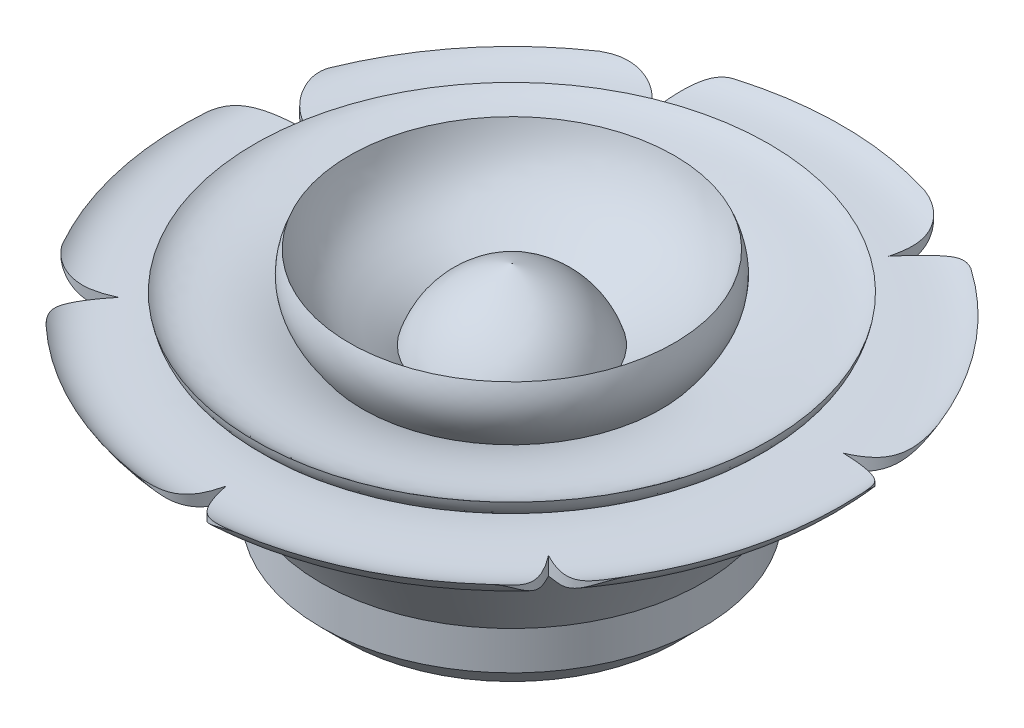
from build123d import *

# Parameters (mm, degrees)
SKETCH2_R           = 9.4615
BOSS_EXTRUDE1_DEPTH = 3.175
CUT_EXTRUDE2_START  = -1.399690459
CUT_EXTRUDE2_DEPTH  = 1.399690459
CHAMFER1_SIZE       = 1.27


# Read off the part's stored shape, not the designer's step: Cut-Extrude2
with BuildPart() as part:
    # Sketch2 → Boss-Extrude1 (new body)
    with BuildSketch(Plane(origin=(0, 0, 0), x_dir=(1, 0, 0), z_dir=(0, 1, 0))):
        with Locations(Location((0, 0, 0), (0, 0, 270))):
            Circle(SKETCH2_R)
    extrude(amount=BOSS_EXTRUDE1_DEPTH)

    # Sketch3 → Revolve3 (revolve)
    with BuildSketch(Plane.XY, mode=Mode.PRIVATE) as revolve3_sk:
        with BuildLine():
            Line((9.4615, 3.175), (7.257823032, 3.175))
            Line((7.257823032, 3.175), (0, 3.175))
            Line((0, 3.175), (0, 12.153777725))
            add(Edge.make_bspline(
                [(0, 12.153777725), (2.13831123, 11.520061757), (3.477438717, 10.35543051), (4.017382463, 8.659883983)],
                knots=[0, 0, 0, 0, 0.540148016, 0.540148016, 0.540148016, 0.540148016], degree=3))
            add(Edge.make_bspline(
                [(4.017382463, 8.659883983), (5.851465131, 10.086959119), (7.298214322, 10.2332866), (8.052368445, 12.767244451)],
                knots=[0, 0, 0, 0, 1, 1, 1, 1], degree=3))
            add(Edge.make_bspline(
                [(7.398197715, 9.601986331), (8.244792265, 10.726441803), (8.557447355, 11.59769491), (8.052368445, 12.767244451)],
                knots=[0, 0, 0, 0, 1, 1, 1, 1], degree=3))
            add(Edge.make_bspline(
                [(7.398197715, 9.601986331), (10.053387197, 10.692724475), (11.796833397, 10.086140267), (12.745602962, 10.91990746)],
                knots=[0, 0, 0, 0, 1, 1, 1, 1], degree=3))
            add(Edge.make_bspline(
                [(8.095139787, 8.271903754), (10.420551443, 10.443790106), (12.411212144, 9.114120654), (12.745602962, 10.91990746)],
                knots=[0, 0, 0, 0, 1, 1, 1, 1], degree=3))
            add(Edge.make_bspline(
                [(8.095139787, 8.271903754), (12.127769803, 10.276347103), (15.085679098, 8.73631301), (16.340420889, 9.921346924)],
                knots=[0, 0, 0, 0, 1, 1, 1, 1], degree=3))
            add(Edge.make_bspline(
                [(14.637486624, 8.782698369), (15.364691678, 8.939207775), (15.934935962, 9.201598821), (16.340420889, 9.921346924)],
                knots=[0, 0, 0, 0, 1, 1, 1, 1], degree=3))
            add(Edge.make_bspline(
                [(12.139796433, 7.333193021), (13.080422963, 8.334541193), (14.637486624, 8.782698369)],
                knots=[0, 0, 0, 1, 1, 1], degree=2))
            Line((12.139796433, 7.333193021), (9.4615, 3.175))
        make_face()
    revolve(revolve3_sk.sketch.rotate(Axis((0, 0, 0), (0, 1, 0)), 270), axis=Axis((0, 0, 0), (0, 1, 0)))

    # Cut-Extrude2 outline → Cut-Extrude2 (cut)
    with BuildSketch(Plane(origin=(0, 9.921346924, 0), x_dir=(1, 0, 0), z_dir=(0, 1, 0)).offset(CUT_EXTRUDE2_START)):
        with BuildLine():
            add(Edge.make_bspline(
                [(-14.237029797, -8.019746718), (-13.662066602, -9.034765434), (-12.593066917, -9.176553695), (-11.030030742, -8.4451115)],
                knots=[0.0017363, 0.0017363, 0.0017363, 0.0017363, 0.458470686, 0.458470686, 0.458470686, 0.458470686], degree=3))
            ThreePointArc((-14.237029797, -8.019746718), (-12.840268084, -10.10627876), (-11.140325119, -11.954183832))
            add(Edge.make_bspline(
                [(-11.140325119, -11.954183832), (-12.138953872, -10.949429748), (-12.284756509, -9.899430024), (-11.030030742, -8.4451115)],
                knots=[0, 0, 0, 0, 0.483922941, 0.483922941, 0.483922941, 0.483922941], degree=3))
        make_face()
        with BuildLine():
            add(Edge.make_bspline(
                [(-2.619707489, -16.129057242), (-1.445527982, -16.2033572), (-0.678660536, -15.573522396), (-0.274457322, -13.889065393)],
                knots=[0, 0, 0, 0, 0.45847077, 0.45847077, 0.45847077, 0.45847077], degree=3))
            ThreePointArc((-2.619707489, -16.129057242), (-0.111032443, -16.340043655), (2.400278166, -16.163168612))
            add(Edge.make_bspline(
                [(2.400278166, -16.163168612), (0.980444158, -16.208481277), (0.080266003, -15.776802052), (-0.274457322, -13.889065393)],
                knots=[0, 0, 0, 0, 0.483922915, 0.483922915, 0.483922915, 0.483922915], degree=3))
        make_face()
        with BuildLine():
            add(Edge.make_bspline(
                [(10.986712076, -12.095516219), (11.848340818, -11.309105631), (11.748698667, -10.235356266), (10.687786979, -8.874269864)],
                knots=[0.001736298, 0.001736298, 0.001736298, 0.001736298, 0.458470686, 0.458470686, 0.458470686, 0.458470686], degree=3))
            ThreePointArc((10.986712076, -12.095516219), (12.710121691, -10.269477175), (14.133423035, -8.200957758))
            add(Edge.make_bspline(
                [(14.133423035, -8.200957758), (13.363767984, -9.428104646), (12.384845451, -9.773920721), (10.687786979, -8.874269864)],
                knots=[0, 0, 0, 0, 0.483922941, 0.483922941, 0.483922941, 0.483922941], degree=3))
        make_face()
        with BuildLine():
            add(Edge.make_bspline(
                [(16.306758312, 1.048326379), (16.22913449, 2.212293837), (15.327517567, 2.803862246), (13.601909749, 2.823031579)],
                knots=[0.001736298, 0.001736298, 0.001736298, 0.001736298, 0.458470686, 0.458470686, 0.458470686, 0.458470686], degree=3))
            ThreePointArc((16.306758312, 1.048326379), (15.953631818, 3.534258995), (15.223812089, 5.936741556))
            add(Edge.make_bspline(
                [(15.223812089, 5.936741556), (15.684063875, 4.593224131), (15.363383763, 3.588922185), (13.601909749, 2.823031579)],
                knots=[0, 0, 0, 0, 0.483922941, 0.483922941, 0.483922941, 0.483922941], degree=3))
        make_face()
        with BuildLine():
            add(Edge.make_bspline(
                [(9.358410555, 13.395129963), (8.289129817, 14.036764565), (7.368550306, 13.736798705), (6.273517267, 12.39453293)],
                knots=[0, 0, 0, 0, 0.458470655, 0.458470655, 0.458470655, 0.458470655], degree=3))
            ThreePointArc((9.358410555, 13.395129963), (7.189716012, 14.673695462), (4.850360131, 15.603953391))
            add(Edge.make_bspline(
                [(4.850360131, 15.603953391), (6.22843121, 15.110529703), (6.772981165, 14.249233767), (6.273517267, 12.39453293)],
                knots=[0, 0, 0, 0, 0.483923025, 0.483923025, 0.483923025, 0.483923025], degree=3))
        make_face()
        with BuildLine():
            add(Edge.make_bspline(
                [(-4.650637756, 15.664639265), (-5.768149423, 15.329954438), (-6.144257485, 14.3193073), (-5.778961944, 12.63269785)],
                knots=[0.0017363, 0.0017363, 0.0017363, 0.0017363, 0.458470784, 0.458470784, 0.458470784, 0.458470784], degree=3))
            ThreePointArc((-4.650637756, 15.664639265), (-6.995664805, 14.767194344), (-9.175511935, 13.52107006))
            add(Edge.make_bspline(
                [(-9.175511935, 13.52107006), (-7.897478737, 14.325178129), (-6.917614694, 14.179580555), (-5.778961944, 12.63269785)],
                knots=[0, 0, 0, 0, 0.483922847, 0.483922847, 0.483922847, 0.483922847], degree=3))
        make_face()
        with BuildLine():
            add(Edge.make_bspline(
                [(-15.146733345, 6.130727838), (-15.581823337, 5.048349466), (-15.026166164, 4.124167673), (-13.479763803, 3.358183439)],
                knots=[0.001736298, 0.001736298, 0.001736298, 0.001736298, 0.458470776, 0.458470776, 0.458470776, 0.458470776], degree=3))
            ThreePointArc((-15.146733345, 6.130727838), (-15.907183106, 3.7377641), (-16.292036368, 1.256545194))
            add(Edge.make_bspline(
                [(-16.292036368, 1.256545194), (-16.116823312, 2.733919585), (-15.3991049, 3.432414908), (-13.479763803, 3.358183439)],
                knots=[0, 0, 0, 0, 0.483922914, 0.483922914, 0.483922914, 0.483922914], degree=3))
        make_face()
    extrude(amount=CUT_EXTRUDE2_DEPTH, mode=Mode.SUBTRACT)

    # Chamfer1
    chamfer1_edges = [part.edges().sort_by_distance(p)[0] for p in [
        (0, 0, -9.4615),
    ]]
    chamfer(chamfer1_edges, length=CHAMFER1_SIZE)


solid = part.part
